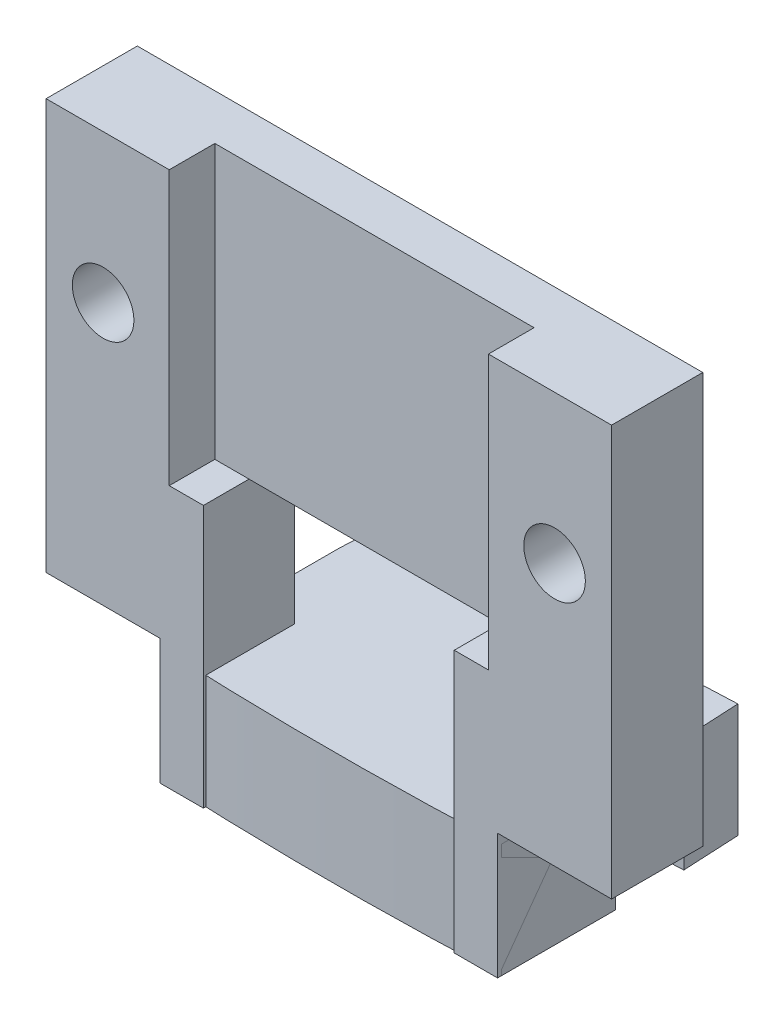
from build123d import *

# Parameters (mm, degrees)
MAIN_DEPTH           = 2
SKETCH8_R            = 1.35
HOLES_DEPTH          = 27.870243765
SKETCH9_W            = 14
SKETCH9_H            = 12
COMPONENTHOLES_DEPTH = 2
SUPPORT_ANGLE        = 5.7
SKETCH11_W           = 5
SKETCH11_H           = 5.5
SUPPORT_CUT_DEPTH    = 29.63712383


with BuildPart() as part:
    # Sketch7 → Main (new, symmetric)
    with BuildSketch(Plane.XY.offset(154.5)):
        Polygon((-12.4, 0), (-5.5, 0), (-5.5, 11.5), (5.5, 11.5), (5.5, 0), (12.4, 0), (12.4, 23.5), (-12.4, 23.5), align=None)
    extrude(amount=MAIN_DEPTH, both=True)

    # Sketch8 → Holes (cut, through all)
    with BuildSketch(Plane.XY.offset(156.5)):
        with Locations((-9.9, 17)):
            Circle(SKETCH8_R)
        with Locations((9.9, 17)):
            Circle(SKETCH8_R)
    extrude(amount=-HOLES_DEPTH, mode=Mode.SUBTRACT)

    # Sketch9 → ComponentHoles (cut)
    with BuildSketch(Plane.XY.offset(156.5)):
        with Locations((0, 17.5)):
            Rectangle(SKETCH9_W, SKETCH9_H)
    extrude(amount=-COMPONENTHOLES_DEPTH, mode=Mode.SUBTRACT)


with BuildPart() as body_2:
    # Sketch10 → Support (revolve, symmetric)
    with BuildSketch(Plane(origin=(0, 0, 0), x_dir=(0, 0, -1), z_dir=(1, 0, 0))) as support_sk:
        Polygon((-147.95, 3.1), (-152.05, 3.1), (-151.5, 2.05), (-151.5, 0), (-156.5, 0), (-156.5, 5), (-146, 5), (-146, 0), (-148.5, 0), (-148.5, 2.05), align=None)
    revolve(axis=Axis((0, 11, 0), (0, -1, 0)), revolution_arc=SUPPORT_ANGLE / 2)
    revolve(support_sk.sketch, axis=Axis((0, 11, 0), (0, 1, 0)), revolution_arc=SUPPORT_ANGLE / 2)


with BuildPart() as support_cut_tool:
    # Sketch11 → Support-Cut (new, through all)
    with BuildSketch(Plane.XY.offset(156.5)):
        with Locations((-9.9, 2.75)):
            Rectangle(SKETCH11_W, SKETCH11_H)
        with Locations((9.9, 2.75)):
            Rectangle(SKETCH11_W, SKETCH11_H)
    extrude(amount=-SUPPORT_CUT_DEPTH)


with BuildPart() as part_1:
    add(part.part)

    # Support-Cut: cut by support_cut_tool
    add(support_cut_tool.part, mode=Mode.SUBTRACT)


with BuildPart() as body_2_1:
    add(body_2.part)

    # Support-Cut: cut by support_cut_tool
    add(support_cut_tool.part, mode=Mode.SUBTRACT)


solid = Compound([part_1.part, body_2_1.part])
